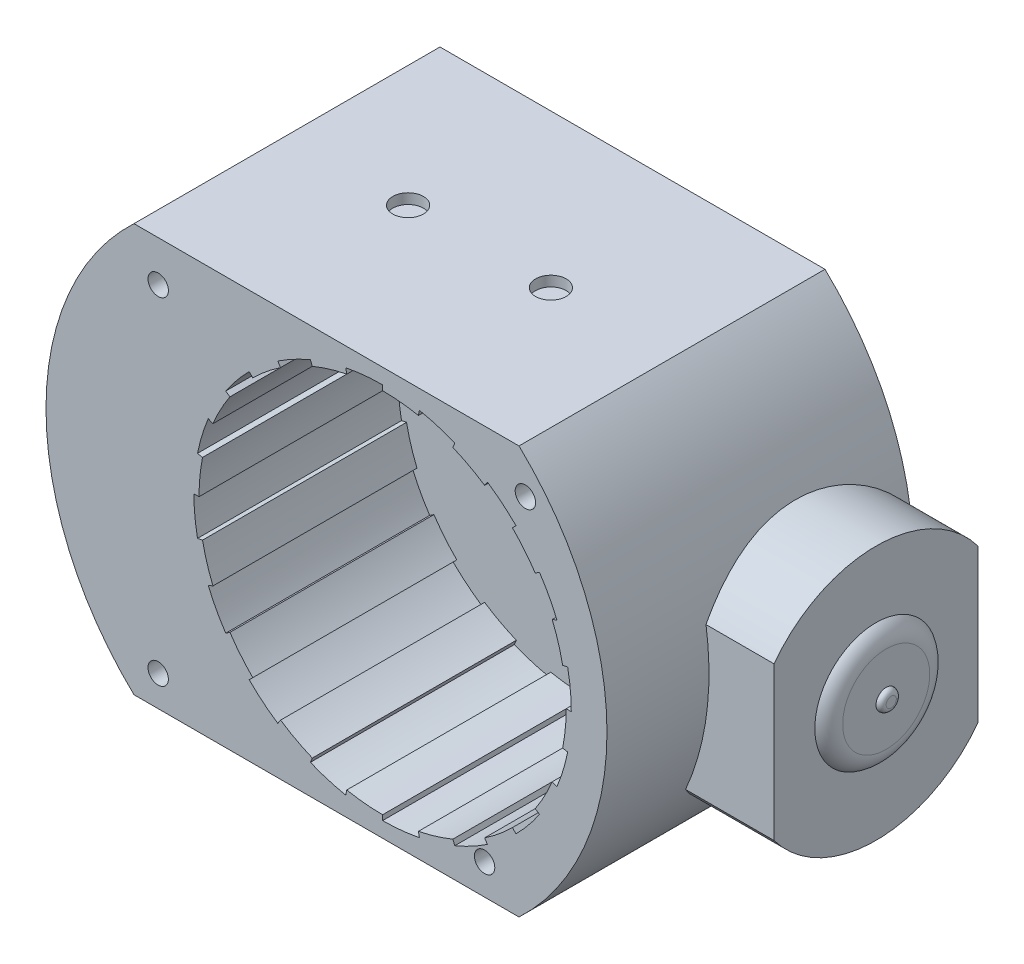
from build123d import *

# Parameters (mm, degrees)
SALIENTE_EXTRUIR1_DEPTH = 15
CORTAR_EXTRUIR1_DEPTH   = 20
SALIENTE_EXTRUIR2_DEPTH = 15
CROQUIS4_R              = 1
CORTAR_EXTRUIR2_DEPTH   = 45.130347805
CROQUIS5_R              = 2.5
CROQUIS5_R_2            = 1
SALIENTE_EXTRUIR3_DEPTH = 5
CROQUIS6_R              = 1
CORTAR_EXTRUIR3_DEPTH   = 50.472089095
CORTAR_EXTRUIR4_DEPTH   = 5
CROQUIS8_R              = 6
SALIENTE_EXTRUIR4_DEPTH = 1
REDONDEO1_R             = 2
CROQUIS9_R              = 1
SALIENTE_EXTRUIR5_DEPTH = 0.492703871
REDONDEO2_R             = 0.5
CROQUIS15_R             = 1.5
CORTAR_EXTRUIR16_DEPTH  = 1


with BuildPart() as part:
    # Croquis1 → Saliente-Extruir1 (new, symmetric)
    with BuildSketch(Plane.XY):
        with BuildLine():
            ThreePointArc((-27.5, 4e-09), (-25.251743677, -10.890337058), (-18.874586088, -20))
            Line((-18.874586088, -20), (18.874586088, -20))
            ThreePointArc((18.874586088, -20), (25.251743677, -10.89033706), (27.5, 0))
            ThreePointArc((27.5, 0), (25.251743677, 10.89033706), (18.874586088, 20))
            Line((18.874586088, 20), (-18.874586088, 20))
            ThreePointArc((-18.874586088, 20), (-25.251743676, 10.890337062), (-27.5, 4e-09))
        make_face()
    extrude(amount=SALIENTE_EXTRUIR1_DEPTH, both=True)

    # Croquis2 → Cortar-Extruir1 (cut)
    with BuildSketch(Plane.XY.offset(15)):
        with BuildLine():
            Line((5.5, 18), (5.5, 0))
            Line((5.5, 0), (9.011625796, 17.654135047))
            ThreePointArc((9.011625796, 17.654135047), (7.264308526, 17.91332508), (5.5, 18))
        make_face()
        with BuildLine():
            Line((-7.227922061, 12.727922061), (5.5, 0))
            Line((5.5, 0), (-4.500264194, 14.966453021))
            ThreePointArc((-4.500264194, 14.966453021), (-5.919079115, 13.914188161), (-7.227922061, 12.727922061))
        make_face()
        with BuildLine():
            Line((-4.500264194, 14.966453021), (5.5, 0))
            Line((5.5, 0), (-1.388301783, 16.629831585))
            ThreePointArc((-1.388301783, 16.629831585), (-2.985141263, 15.874582758), (-4.500264194, 14.966453021))
        make_face()
        with BuildLine():
            Line((-1.388301783, 16.629831585), (5.5, 0))
            Line((5.5, 0), (1.988374204, 17.654135047))
            ThreePointArc((1.988374204, 17.654135047), (0.274875809, 17.224926043), (-1.388301783, 16.629831585))
        make_face()
        with BuildLine():
            Line((1.988374204, 17.654135047), (5.5, 0))
            Line((5.5, 0), (5.5, 18))
            ThreePointArc((5.5, 18), (3.735691474, 17.91332508), (1.988374204, 17.654135047))
        make_face()
        with BuildLine():
            Line((9.011625796, 17.654135047), (5.5, 0))
            Line((5.5, 0), (12.388301783, 16.629831585))
            ThreePointArc((12.388301783, 16.629831585), (10.725124191, 17.224926043), (9.011625796, 17.654135047))
        make_face()
        with BuildLine():
            Line((12.388301783, 16.629831585), (5.5, 0))
            Line((5.5, 0), (15.500264194, 14.966453021))
            ThreePointArc((15.500264194, 14.966453021), (13.985141263, 15.874582758), (12.388301783, 16.629831585))
        make_face()
        with BuildLine():
            Line((15.500264194, 14.966453021), (5.5, 0))
            Line((5.5, 0), (18.227922061, 12.727922061))
            ThreePointArc((18.227922061, 12.727922061), (16.919079115, 13.914188161), (15.500264194, 14.966453021))
        make_face()
        with BuildLine():
            Line((18.227922061, 12.727922061), (5.5, 0))
            Line((5.5, 0), (20.466453021, 10.000264194))
            ThreePointArc((20.466453021, 10.000264194), (19.414188161, 11.419079115), (18.227922061, 12.727922061))
        make_face()
        with BuildLine():
            Line((20.466453021, 10.000264194), (5.5, 0))
            Line((5.5, 0), (22.129831585, 6.888301783))
            ThreePointArc((22.129831585, 6.888301783), (21.374582758, 8.485141263), (20.466453021, 10.000264194))
        make_face()
        with BuildLine():
            Line((22.129831585, 6.888301783), (5.5, 0))
            Line((5.5, 0), (23.154135047, 3.511625796))
            ThreePointArc((23.154135047, 3.511625796), (22.724926043, 5.225124191), (22.129831585, 6.888301783))
        make_face()
        with BuildLine():
            Line((23.154135047, 3.511625796), (5.5, 0))
            Line((5.5, 0), (23.5, 0))
            ThreePointArc((23.5, 0), (23.41332508, 1.764308526), (23.154135047, 3.511625796))
        make_face()
        with BuildLine():
            Line((23.5, 0), (5.5, 0))
            Line((5.5, 0), (23.154135047, -3.511625796))
            ThreePointArc((23.154135047, -3.511625796), (23.41332508, -1.764308526), (23.5, 0))
        make_face()
        with BuildLine():
            Line((-9.466453021, 10.000264194), (5.5, 0))
            Line((5.5, 0), (-7.227922061, 12.727922061))
            ThreePointArc((-7.227922061, 12.727922061), (-8.414188161, 11.419079115), (-9.466453021, 10.000264194))
        make_face()
        with BuildLine():
            Line((-11.129831585, 6.888301783), (5.5, 0))
            Line((5.5, 0), (-9.466453021, 10.000264194))
            ThreePointArc((-9.466453021, 10.000264194), (-10.374582758, 8.485141263), (-11.129831585, 6.888301783))
        make_face()
        with BuildLine():
            Line((-12.154135047, 3.511625796), (5.5, 0))
            Line((5.5, 0), (-11.129831585, 6.888301783))
            ThreePointArc((-11.129831585, 6.888301783), (-11.724926043, 5.225124191), (-12.154135047, 3.511625796))
        make_face()
        with BuildLine():
            Line((-12.5, 0), (5.5, 0))
            Line((5.5, 0), (-12.154135047, 3.511625796))
            ThreePointArc((-12.154135047, 3.511625796), (-12.41332508, 1.764308526), (-12.5, 0))
        make_face()
        with BuildLine():
            Line((-12.154135047, -3.511625796), (5.5, 0))
            Line((5.5, 0), (-12.5, 0))
            ThreePointArc((-12.5, 0), (-12.41332508, -1.764308526), (-12.154135047, -3.511625796))
        make_face()
        with BuildLine():
            Line((-11.129831585, -6.888301783), (5.5, 0))
            Line((5.5, 0), (-12.154135047, -3.511625796))
            ThreePointArc((-12.154135047, -3.511625796), (-11.724926043, -5.225124191), (-11.129831585, -6.888301783))
        make_face()
        with BuildLine():
            Line((-9.466453021, -10.000264194), (5.5, 0))
            Line((5.5, 0), (-11.129831585, -6.888301783))
            ThreePointArc((-11.129831585, -6.888301783), (-10.374582758, -8.485141263), (-9.466453021, -10.000264194))
        make_face()
        with BuildLine():
            Line((-7.227922061, -12.727922061), (5.5, 0))
            Line((5.5, 0), (-9.466453021, -10.000264194))
            ThreePointArc((-9.466453021, -10.000264194), (-8.414188161, -11.419079115), (-7.227922061, -12.727922061))
        make_face()
        with BuildLine():
            Line((-4.500264194, -14.966453021), (5.5, 0))
            Line((5.5, 0), (-7.227922061, -12.727922061))
            ThreePointArc((-7.227922061, -12.727922061), (-5.919079115, -13.914188161), (-4.500264194, -14.966453021))
        make_face()
        with BuildLine():
            Line((-1.388301783, -16.629831585), (5.5, 0))
            Line((5.5, 0), (-4.500264194, -14.966453021))
            ThreePointArc((-4.500264194, -14.966453021), (-2.985141263, -15.874582758), (-1.388301783, -16.629831585))
        make_face()
        with BuildLine():
            Line((1.988374204, -17.654135047), (5.5, 0))
            Line((5.5, 0), (-1.388301783, -16.629831585))
            ThreePointArc((-1.388301783, -16.629831585), (0.274875809, -17.224926043), (1.988374204, -17.654135047))
        make_face()
        with BuildLine():
            Line((5.5, -18), (5.5, 0))
            Line((5.5, 0), (1.988374204, -17.654135047))
            ThreePointArc((1.988374204, -17.654135047), (3.735691474, -17.91332508), (5.5, -18))
        make_face()
        with BuildLine():
            Line((9.011625796, -17.654135047), (5.5, 0))
            Line((5.5, 0), (5.5, -18))
            ThreePointArc((5.5, -18), (7.264308526, -17.91332508), (9.011625796, -17.654135047))
        make_face()
        with BuildLine():
            Line((12.388301783, -16.629831585), (5.5, 0))
            Line((5.5, 0), (9.011625796, -17.654135047))
            ThreePointArc((9.011625796, -17.654135047), (10.725124191, -17.224926043), (12.388301783, -16.629831585))
        make_face()
        with BuildLine():
            Line((15.500264194, -14.966453021), (5.5, 0))
            Line((5.5, 0), (12.388301783, -16.629831585))
            ThreePointArc((12.388301783, -16.629831585), (13.985141263, -15.874582758), (15.500264194, -14.966453021))
        make_face()
        with BuildLine():
            Line((18.227922061, -12.727922061), (5.5, 0))
            Line((5.5, 0), (15.500264194, -14.966453021))
            ThreePointArc((15.500264194, -14.966453021), (16.919079115, -13.914188161), (18.227922061, -12.727922061))
        make_face()
        with BuildLine():
            Line((20.466453021, -10.000264194), (5.5, 0))
            Line((5.5, 0), (18.227922061, -12.727922061))
            ThreePointArc((18.227922061, -12.727922061), (19.414188161, -11.419079115), (20.466453021, -10.000264194))
        make_face()
        with BuildLine():
            Line((22.129831585, -6.888301783), (5.5, 0))
            Line((5.5, 0), (20.466453021, -10.000264194))
            ThreePointArc((20.466453021, -10.000264194), (21.374582758, -8.485141263), (22.129831585, -6.888301783))
        make_face()
        with BuildLine():
            Line((23.154135047, -3.511625796), (5.5, 0))
            Line((5.5, 0), (22.129831585, -6.888301783))
            ThreePointArc((22.129831585, -6.888301783), (22.724926043, -5.225124191), (23.154135047, -3.511625796))
        make_face()
        with BuildLine():
            ThreePointArc((1.988374204, 17.654135047), (3.735691474, 17.91332508), (5.5, 18))
            Line((5.5, 18), (5.5, 18.5))
            ThreePointArc((5.5, 18.5), (3.686682904, 18.410917443), (1.890829043, 18.144527687))
            Line((1.890829043, 18.144527687), (1.988374204, 17.654135047))
        make_face()
        with BuildLine():
            Line((-4.778049311, 15.382187828), (-4.500264194, 14.966453021))
            ThreePointArc((-4.500264194, 14.966453021), (-2.985141263, 15.874582758), (-1.388301783, 16.629831585))
            Line((-1.388301783, 16.629831585), (-1.579643499, 17.091771351))
            ThreePointArc((-1.579643499, 17.091771351), (-3.220839631, 16.31554339), (-4.778049311, 15.382187828))
        make_face()
        with BuildLine():
            Line((-9.882187828, 10.278049311), (-9.466453021, 10.000264194))
            ThreePointArc((-9.466453021, 10.000264194), (-8.414188161, 11.419079115), (-7.227922061, 12.727922061))
            Line((-7.227922061, 12.727922061), (-7.581475452, 13.081475452))
            ThreePointArc((-7.581475452, 13.081475452), (-8.800693387, 11.736275757), (-9.882187828, 10.278049311))
        make_face()
        with BuildLine():
            Line((-12.644527687, 3.609170957), (-12.154135047, 3.511625796))
            ThreePointArc((-12.154135047, 3.511625796), (-11.724926043, 5.225124191), (-11.129831585, 6.888301783))
            Line((-11.129831585, 6.888301783), (-11.591771351, 7.079643499))
            ThreePointArc((-11.591771351, 7.079643499), (-12.203396211, 5.370266529), (-12.644527687, 3.609170957))
        make_face()
        with BuildLine():
            Line((-12.644527687, -3.609170957), (-12.154135047, -3.511625796))
            ThreePointArc((-12.154135047, -3.511625796), (-12.41332508, -1.764308526), (-12.5, 0))
            Line((-12.5, 0), (-13, 0))
            ThreePointArc((-13, 0), (-12.910917443, -1.813317096), (-12.644527687, -3.609170957))
        make_face()
        with BuildLine():
            Line((-9.882187828, -10.278049311), (-9.466453021, -10.000264194))
            ThreePointArc((-9.466453021, -10.000264194), (-10.374582758, -8.485141263), (-11.129831585, -6.888301783))
            Line((-11.129831585, -6.888301783), (-11.591771351, -7.079643499))
            ThreePointArc((-11.591771351, -7.079643499), (-10.81554339, -8.720839631), (-9.882187828, -10.278049311))
        make_face()
        with BuildLine():
            Line((-4.778049311, -15.382187828), (-4.500264194, -14.966453021))
            ThreePointArc((-4.500264194, -14.966453021), (-5.919079115, -13.914188161), (-7.227922061, -12.727922061))
            Line((-7.227922061, -12.727922061), (-7.581475452, -13.081475452))
            ThreePointArc((-7.581475452, -13.081475452), (-6.236275757, -14.300693387), (-4.778049311, -15.382187828))
        make_face()
        with BuildLine():
            Line((1.890829043, -18.144527687), (1.988374204, -17.654135047))
            ThreePointArc((1.988374204, -17.654135047), (0.274875809, -17.224926043), (-1.388301783, -16.629831585))
            Line((-1.388301783, -16.629831585), (-1.579643499, -17.091771351))
            ThreePointArc((-1.579643499, -17.091771351), (0.129733471, -17.703396211), (1.890829043, -18.144527687))
        make_face()
        with BuildLine():
            Line((9.109170957, -18.144527687), (9.011625796, -17.654135047))
            ThreePointArc((9.011625796, -17.654135047), (7.264308526, -17.91332508), (5.5, -18))
            Line((5.5, -18), (5.5, -18.5))
            ThreePointArc((5.5, -18.5), (7.313317096, -18.410917443), (9.109170957, -18.144527687))
        make_face()
        with BuildLine():
            Line((15.778049311, -15.382187828), (15.500264194, -14.966453021))
            ThreePointArc((15.500264194, -14.966453021), (13.985141263, -15.874582758), (12.388301783, -16.629831585))
            Line((12.388301783, -16.629831585), (12.579643499, -17.091771351))
            ThreePointArc((12.579643499, -17.091771351), (14.220839631, -16.31554339), (15.778049311, -15.382187828))
        make_face()
        with BuildLine():
            Line((20.882187828, -10.278049311), (20.466453021, -10.000264194))
            ThreePointArc((20.466453021, -10.000264194), (19.414188161, -11.419079115), (18.227922061, -12.727922061))
            Line((18.227922061, -12.727922061), (18.581475452, -13.081475452))
            ThreePointArc((18.581475452, -13.081475452), (19.800693387, -11.736275757), (20.882187828, -10.278049311))
        make_face()
        with BuildLine():
            Line((23.644527687, -3.609170957), (23.154135047, -3.511625796))
            ThreePointArc((23.154135047, -3.511625796), (22.724926043, -5.225124191), (22.129831585, -6.888301783))
            Line((22.129831585, -6.888301783), (22.591771351, -7.079643499))
            ThreePointArc((22.591771351, -7.079643499), (23.203396211, -5.370266529), (23.644527687, -3.609170957))
        make_face()
        with BuildLine():
            Line((23.644527687, 3.609170957), (23.154135047, 3.511625796))
            ThreePointArc((23.154135047, 3.511625796), (23.41332508, 1.764308526), (23.5, 0))
            Line((23.5, 0), (24, 0))
            ThreePointArc((24, 0), (23.910917443, 1.813317096), (23.644527687, 3.609170957))
        make_face()
        with BuildLine():
            Line((20.882187828, 10.278049311), (20.466453021, 10.000264194))
            ThreePointArc((20.466453021, 10.000264194), (21.374582758, 8.485141263), (22.129831585, 6.888301783))
            Line((22.129831585, 6.888301783), (22.591771351, 7.079643499))
            ThreePointArc((22.591771351, 7.079643499), (21.81554339, 8.720839631), (20.882187828, 10.278049311))
        make_face()
        with BuildLine():
            Line((15.778049311, 15.382187828), (15.500264194, 14.966453021))
            ThreePointArc((15.500264194, 14.966453021), (16.919079115, 13.914188161), (18.227922061, 12.727922061))
            Line((18.227922061, 12.727922061), (18.581475452, 13.081475452))
            ThreePointArc((18.581475452, 13.081475452), (17.236275757, 14.300693387), (15.778049311, 15.382187828))
        make_face()
        with BuildLine():
            Line((9.109170957, 18.144527687), (9.011625796, 17.654135047))
            ThreePointArc((9.011625796, 17.654135047), (10.725124191, 17.224926043), (12.388301783, 16.629831585))
            Line((12.388301783, 16.629831585), (12.579643499, 17.091771351))
            ThreePointArc((12.579643499, 17.091771351), (10.870266529, 17.703396211), (9.109170957, 18.144527687))
        make_face()
    extrude(amount=-CORTAR_EXTRUIR1_DEPTH, mode=Mode.SUBTRACT)

    # Croquis3 → Saliente-Extruir2 (add)
    with BuildSketch(Plane(origin=(18.874586088, 0, 0), x_dir=(0, 0, -1), z_dir=(1, 0, 0))):
        with BuildLine():
            ThreePointArc((4.99999999, -16), (10.590169939, -14.68033989), (15, -11))
            Line((15, -11), (15, 4))
            ThreePointArc((15, 4), (5, 9), (-5, 4))
            Line((-5, 4), (-5, -11))
            ThreePointArc((-5, -11), (-0.590169948, -14.680339885), (4.99999999, -16))
        make_face()
    extrude(amount=SALIENTE_EXTRUIR2_DEPTH)

    # Croquis4 → Cortar-Extruir2 (cut, through all)
    with BuildSketch(Plane.XY.offset(-5)):
        with Locations((5.5, 0)):
            Circle(CROQUIS4_R)
    extrude(amount=-CORTAR_EXTRUIR2_DEPTH, mode=Mode.SUBTRACT)

    # Croquis5 → Saliente-Extruir3 (add)
    with BuildSketch(Plane(origin=(0, 0, -15), x_dir=(-1, 0, 0), z_dir=(0, 0, -1))):
        with Locations(Location((-5.5, 0, 0), (0, 0, 180))):
            Circle(CROQUIS5_R)
        with Locations(Location((-5.5, 0, 0), (0, 0, 180))):
            Circle(CROQUIS5_R_2, mode=Mode.SUBTRACT)
    extrude(amount=SALIENTE_EXTRUIR3_DEPTH)

    # Croquis6 → Cortar-Extruir3 (cut, through all)
    with BuildSketch(Plane(origin=(0, 0, -15), x_dir=(-1, 0, 0), z_dir=(0, 0, -1))):
        with Locations((-19.5, 16)):
            Circle(CROQUIS6_R)
        with Locations((16.5, 16)):
            Circle(CROQUIS6_R)
        with Locations((16.5, -17)):
            Circle(CROQUIS6_R)
        with Locations((-15.5, -17)):
            Circle(CROQUIS6_R)
    extrude(amount=-CORTAR_EXTRUIR3_DEPTH, mode=Mode.SUBTRACT)

    # Croquis7 → Cortar-Extruir4 (cut)
    with BuildSketch(Plane(origin=(0, 0, -15), x_dir=(-1, 0, 0), z_dir=(0, 0, -1))):
        with BuildLine():
            Line((-15.803427689, -8.727492488), (-28.626295275, -8.727492488))
            ThreePointArc((-28.626295275, -8.727492488), (-29.853787763, -7.5), (-28.626295275, -6.272507512))
            Line((-28.626295275, -6.272507512), (-15.803427689, -6.272507512))
            ThreePointArc((-15.803427689, -6.272507512), (-14.5759352, -7.5), (-15.803427689, -8.727492488))
        make_face()
        with BuildLine():
            Line((-15.803427689, 1.727492488), (-28.626295275, 1.727492488))
            ThreePointArc((-28.626295275, 1.727492488), (-29.853787763, 0.5), (-28.626295275, -0.727492488))
            Line((-28.626295275, -0.727492488), (-15.803427689, -0.727492488))
            ThreePointArc((-15.803427689, -0.727492488), (-14.5759352, 0.5), (-15.803427689, 1.727492488))
        make_face()
    extrude(amount=-CORTAR_EXTRUIR4_DEPTH, mode=Mode.SUBTRACT)

    # Croquis8 → Saliente-Extruir4 (add)
    with BuildSketch(Plane(origin=(33.874586088, 0, 0), x_dir=(0, 0, -1), z_dir=(1, 0, 0))):
        with Locations((5, -3.5)):
            Circle(CROQUIS8_R)
    extrude(amount=SALIENTE_EXTRUIR4_DEPTH)

    # Redondeo1
    # the kernel refuses this fillet: 2 mm, written as the material it takes off along each edge
    with BuildSketch(Plane(origin=(34.874586088, -3.5, -5), x_dir=(0, 0, -1), z_dir=(0, -1, 0))) as redondeo1_piece_1:
        with BuildLine():
            CenterArc((4.267949192, -2), REDONDEO1_R, 30, 60)
            Line((4.267949192, 0), (4.267949192, 0.04))
            Line((4.267949192, 0.04), (6, 0.04))
            Line((6, 0.04), (6.04, 0))
            ThreePointArc((6.04, 0), (6.04, -0.5), (6.034641016, -0.98))
            Line((6.034641016, -0.98), (6, -1))
        make_face()
    revolve(axis=Axis((34.874586088, -3.5, -5), (1, 0, 0)), mode=Mode.SUBTRACT)

    # Croquis9 → Saliente-Extruir5 (add)
    with BuildSketch(Plane(origin=(34.874586088, 0, 0), x_dir=(0, 0, -1), z_dir=(1, 0, 0))):
        with Locations((5, -3.5)):
            Circle(CROQUIS9_R)
    extrude(amount=SALIENTE_EXTRUIR5_DEPTH)

    # Redondeo2
    # the kernel refuses this fillet: 0.5 mm, written as the material it takes off along each edge
    with BuildSketch(Plane(origin=(35.367289959, -3.5, -5), x_dir=(0, 0, -1), z_dir=(0, -1, 0))) as redondeo2_piece_1_section:
        with BuildLine():
            CenterArc((1 - REDONDEO2_R, -REDONDEO2_R), REDONDEO2_R, 0, 90)
            Line((1 - REDONDEO2_R, 0), (1, 0))
            Line((1, 0), (1, -REDONDEO2_R))
        make_face()
    redondeo2_piece_1 = revolve(axis=Axis((35.367289959, -3.5, -5), (1, 0, 0)), mode=Mode.PRIVATE)
    redondeo2_piece_1 = split(redondeo2_piece_1, bisect_by=Plane(origin=(34.874586088, -3.5, -4.14406667), z_dir=(1, 0, 0)), keep=Keep.TOP, mode=Mode.PRIVATE)
    add(redondeo2_piece_1, mode=Mode.SUBTRACT)

    # Croquis15 → Cortar-Extruir16 (cut)
    with BuildSketch(Plane(origin=(0, 20, 0), x_dir=(1, 0, 0), z_dir=(0, 1, 0))):
        with Locations(Location((7, 0, 0), (0, 0, 270))):
            Circle(CROQUIS15_R)
        with Locations(Location((-7, 0, 0), (0, 0, 270))):
            Circle(CROQUIS15_R)
    cortar_extruir16 = extrude(amount=-CORTAR_EXTRUIR16_DEPTH, mode=Mode.SUBTRACT)

    # Simetría1: Cortar-Extruir16 across plane
    add(cortar_extruir16.mirror(Plane.ZX), mode=Mode.SUBTRACT)


solid = part.part
